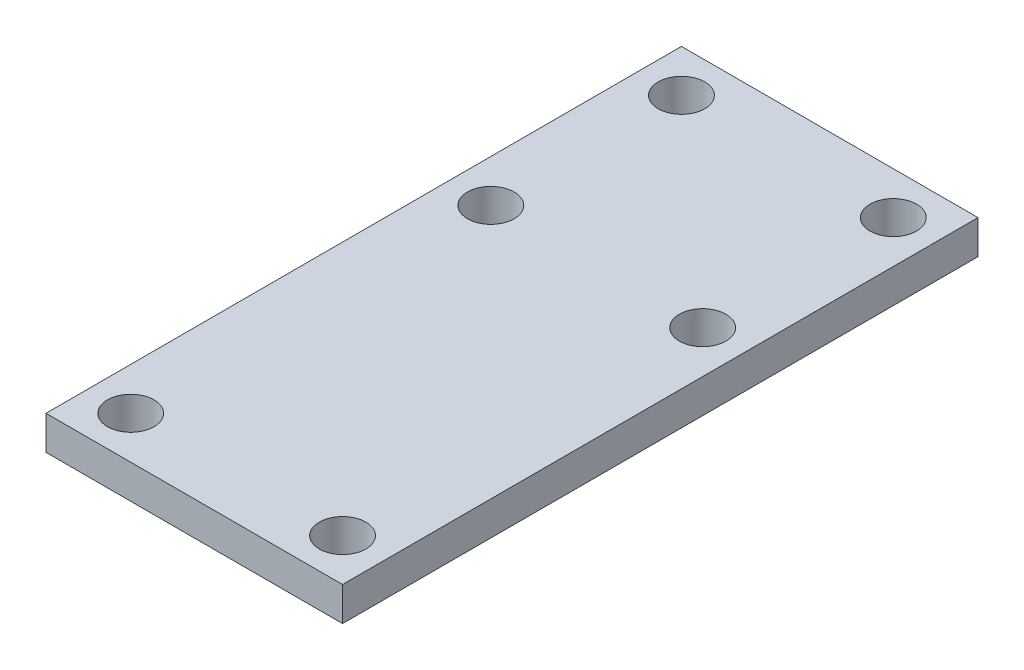
from build123d import *

# Parameters (mm, degrees)
SKETCH1_W                = 14
SKETCH1_H                = 30
BOSS_EXTRUDE1_DEPTH      = 1.6
M2_CLEARANCE_HOLE1_D     = 2.2
M2_CLEARANCE_HOLE1_DEPTH = 5.2
M2_CLEARANCE_HOLE1_TIP   = 0.660946681
CUT_EXTRUDE3_DEPTH       = 0.001


with BuildPart() as part:
    # Sketch1 → Boss-Extrude1 (new body)
    with BuildSketch(Plane(origin=(0, 0, 0), x_dir=(1, 0, 0), z_dir=(0, 1, 0))):
        Rectangle(SKETCH1_W, SKETCH1_H)
    extrude(amount=BOSS_EXTRUDE1_DEPTH)

    # M2 Clearance Hole1
    with Locations(Plane(origin=(0, 1.6, 0), x_dir=(1, 0, 0), z_dir=(0, 1, 0))):
        with Locations((-5, 13), (-5, 4), (-5, -13), (5, -13), (5, 4), (5, 13)):
            Hole(M2_CLEARANCE_HOLE1_D / 2, depth=M2_CLEARANCE_HOLE1_DEPTH)
            with Locations((0, 0, -(M2_CLEARANCE_HOLE1_DEPTH + M2_CLEARANCE_HOLE1_TIP / 2))):  # 118° drill point
                Cone(0, M2_CLEARANCE_HOLE1_D / 2, M2_CLEARANCE_HOLE1_TIP, mode=Mode.SUBTRACT)

    # Sketch5 → Cut-Extrude3 (cut)
    with BuildSketch(Plane.XZ):
        with BuildLine():
            Line((7, 15), (3, 15))
            Line((3, 15), (3, 2.5))
            ThreePointArc((3, 2.5), (2.267766953, 0.732233047), (0.5, 0))
            Line((0.5, 0), (-0.5, 0))
            ThreePointArc((-0.5, 0), (-2.267766953, 0.732233047), (-3, 2.5))
            Line((-3, 2.5), (-3, 15))
            Line((-3, 15), (-7, 15))
            Line((-7, 15), (-7, -15))
            Line((-7, -15), (-3, -15))
            Line((-3, -15), (-3, -9.5))
            ThreePointArc((-3, -9.5), (-2.267766953, -7.732233047), (-0.5, -7))
            Line((-0.5, -7), (0.5, -7))
            ThreePointArc((0.5, -7), (2.267766953, -7.732233047), (3, -9.5))
            Line((3, -9.5), (3, -15))
            Line((3, -15), (7, -15))
            Line((7, -15), (7, 15))
        make_face()
    extrude(amount=-CUT_EXTRUDE3_DEPTH, mode=Mode.SUBTRACT)


solid = part.part
